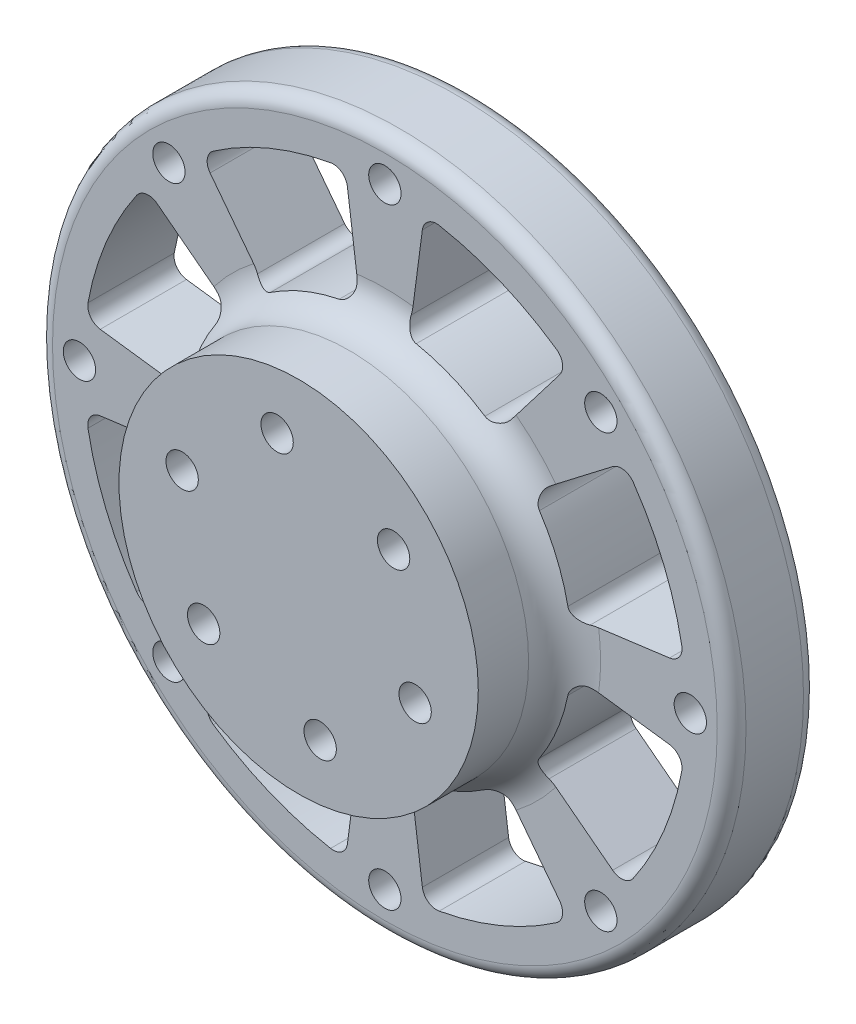
from build123d import *

# Parameters (mm, degrees)
SKETCH_1_R          = 48.25
SKETCH_1_R_2        = 2.25
EXTRUDE_1_DEPTH     = 12
SKETCH_2_R          = 25
SKETCH_2_R_2        = 2.25
EXTRUDE_3_DEPTH     = 12
CUT_EXTRUDE_START   = -53
SKETCH_5_R          = 2.25
CUT_EXTRUDE_2_DEPTH = 53
FILLET_1_R          = 5
FILLET_2_R          = 2
CUT_EXTRUDE_3_DEPTH = 53
FILLET_3_R          = 2


with BuildPart() as part:
    # 草图1 → 凸台-拉伸1 (new body)
    with BuildSketch(Plane.XY):
        Circle(SKETCH_1_R)
        with Locations((0, 42.5)):
            Circle(SKETCH_1_R_2, mode=Mode.SUBTRACT)
        with Locations((30.0520382, 30.0520382)):
            Circle(SKETCH_1_R_2, mode=Mode.SUBTRACT)
        with Locations((42.5, 0)):
            Circle(SKETCH_1_R_2, mode=Mode.SUBTRACT)
        with Locations((30.0520382, -30.0520382)):
            Circle(SKETCH_1_R_2, mode=Mode.SUBTRACT)
        with Locations((0, -42.5)):
            Circle(SKETCH_1_R_2, mode=Mode.SUBTRACT)
        with Locations((-30.0520382, -30.0520382)):
            Circle(SKETCH_1_R_2, mode=Mode.SUBTRACT)
        with Locations((-42.5, 0)):
            Circle(SKETCH_1_R_2, mode=Mode.SUBTRACT)
        with Locations((-30.0520382, 30.0520382)):
            Circle(SKETCH_1_R_2, mode=Mode.SUBTRACT)
    extrude(amount=EXTRUDE_1_DEPTH)

    # 草图2 → 凸台-拉伸3 (add)
    with BuildSketch(Plane.XY.offset(12)):
        Circle(SKETCH_2_R)
        with Locations((2.995431065, -16.987933739)):
            Circle(SKETCH_2_R_2, mode=Mode.SUBTRACT)
        with Locations((-2.995431065, 16.987933739)):
            Circle(SKETCH_2_R_2, mode=Mode.SUBTRACT)
        with Locations((16.209697709, -5.899847472)):
            Circle(SKETCH_2_R_2, mode=Mode.SUBTRACT)
        with Locations((13.214266644, 11.088086267)):
            Circle(SKETCH_2_R_2, mode=Mode.SUBTRACT)
        with Locations((-13.214266644, -11.088086267)):
            Circle(SKETCH_2_R_2, mode=Mode.SUBTRACT)
        with Locations((-16.209697709, 5.899847472)):
            Circle(SKETCH_2_R_2, mode=Mode.SUBTRACT)
    extrude(amount=EXTRUDE_3_DEPTH)

    # 草图5 → 切除-拉伸2 (cut)
    with BuildSketch(Plane.XY.offset(24).offset(CUT_EXTRUDE_START)):
        with Locations((2.995431065, -16.987933739)):
            Circle(SKETCH_5_R)
        with Locations((16.209697709, -5.899847472)):
            Circle(SKETCH_5_R)
        with Locations((13.214266644, 11.088086267)):
            Circle(SKETCH_5_R)
        with Locations((-2.995431065, 16.987933739)):
            Circle(SKETCH_5_R)
        with Locations((-13.214266644, -11.088086267)):
            Circle(SKETCH_5_R)
        with Locations((-16.209697709, 5.899847472)):
            Circle(SKETCH_5_R)
    extrude(amount=CUT_EXTRUDE_2_DEPTH, mode=Mode.SUBTRACT)

    # 圆角1
    fillet_1_edges = [part.edges().sort_by_distance(p)[0] for p in [
        (-25, 0, 12),
    ]]
    fillet(fillet_1_edges, radius=FILLET_1_R)

    # 圆角2
    fillet_2_edges = [part.edges().sort_by_distance(p)[0] for p in [
        (-48.25, 0, 12),
        (-48.25, 0, 0),
    ]]
    fillet(fillet_2_edges, radius=FILLET_2_R)

    # 草图6 → 切除-拉伸3 (cut)
    with BuildSketch(Plane(origin=(0, 0, 0), x_dir=(-1, 0, 0), z_dir=(0, 0, -1))):
        with BuildLine():
            ThreePointArc((-16.436558583, 21.420540188), (-10.332452674, 24.944747378), (-3.52420719, 26.769011257))
            Line((-3.52420719, 26.769011257), (-5.482100073, 41.640684178))
            ThreePointArc((-5.482100073, 41.640684178), (-16.072704159, 38.802940365), (-25.567980018, 33.320840292))
            Line((-25.567980018, 33.320840292), (-16.436558583, 21.420540188))
        make_face()
        with BuildLine():
            Line((5.482100073, 41.640684178), (3.52420719, 26.769011257))
            ThreePointArc((3.52420719, 26.769011257), (10.332452674, 24.944747378), (16.436558583, 21.420540188))
            Line((16.436558583, 21.420540188), (25.567980018, 33.320840292))
            ThreePointArc((25.567980018, 33.320840292), (16.072704159, 38.802940365), (5.482100073, 41.640684178))
        make_face()
        with BuildLine():
            Line((33.320840292, 25.567980018), (21.420540188, 16.436558583))
            ThreePointArc((21.420540188, 16.436558583), (24.944747378, 10.332452674), (26.769011257, 3.52420719))
            Line((26.769011257, 3.52420719), (41.640684178, 5.482100073))
            ThreePointArc((41.640684178, 5.482100073), (38.802940365, 16.072704159), (33.320840292, 25.567980018))
        make_face()
        with BuildLine():
            Line((41.640684178, -5.482100073), (26.769011257, -3.52420719))
            ThreePointArc((26.769011257, -3.52420719), (24.944747378, -10.332452674), (21.420540188, -16.436558583))
            Line((21.420540188, -16.436558583), (33.320840292, -25.567980018))
            ThreePointArc((33.320840292, -25.567980018), (38.802940365, -16.072704159), (41.640684178, -5.482100073))
        make_face()
        with BuildLine():
            Line((25.567980018, -33.320840292), (16.436558583, -21.420540188))
            ThreePointArc((16.436558583, -21.420540188), (10.332452674, -24.944747378), (3.52420719, -26.769011257))
            Line((3.52420719, -26.769011257), (5.482100073, -41.640684178))
            ThreePointArc((5.482100073, -41.640684178), (16.072704159, -38.802940365), (25.567980018, -33.320840292))
        make_face()
        with BuildLine():
            Line((-5.482100073, -41.640684178), (-3.52420719, -26.769011257))
            ThreePointArc((-3.52420719, -26.769011257), (-10.332452674, -24.944747378), (-16.436558583, -21.420540188))
            Line((-16.436558583, -21.420540188), (-25.567980018, -33.320840292))
            ThreePointArc((-25.567980018, -33.320840292), (-16.072704159, -38.802940365), (-5.482100073, -41.640684178))
        make_face()
        with BuildLine():
            Line((-33.320840292, -25.567980018), (-21.420540188, -16.436558583))
            ThreePointArc((-21.420540188, -16.436558583), (-24.944747378, -10.332452674), (-26.769011257, -3.52420719))
            Line((-26.769011257, -3.52420719), (-41.640684178, -5.482100073))
            ThreePointArc((-41.640684178, -5.482100073), (-38.802940365, -16.072704159), (-33.320840292, -25.567980018))
        make_face()
        with BuildLine():
            Line((-41.640684178, 5.482100073), (-26.769011257, 3.52420719))
            ThreePointArc((-26.769011257, 3.52420719), (-24.944747378, 10.332452674), (-21.420540188, 16.436558583))
            Line((-21.420540188, 16.436558583), (-33.320840292, 25.567980018))
            ThreePointArc((-33.320840292, 25.567980018), (-38.802940365, 16.072704159), (-41.640684178, 5.482100073))
        make_face()
    extrude(amount=-CUT_EXTRUDE_3_DEPTH, mode=Mode.SUBTRACT)

    # 圆角3
    fillet_3_edges = [part.edges().sort_by_distance(p)[0] for p in [
        (-26.769011257, 3.52420719, 6.5),
        (-21.420540188, 16.436558583, 6.5),
        (-33.320840292, 25.567980018, 6),
        (-41.640684178, 5.482100073, 6),
        (-5.482100073, 41.640684178, 6),
        (-25.567980018, 33.320840292, 6),
        (-3.52420719, 26.769011257, 6.5),
        (-16.436558583, 21.420540188, 6.5),
        (16.436558583, 21.420540188, 6.5),
        (3.52420719, 26.769011257, 6.5),
        (25.567980018, 33.320840292, 6),
        (5.482100073, 41.640684178, 6),
        (41.640684178, 5.482100073, 6),
        (33.320840292, 25.567980018, 6),
        (21.420540188, 16.436558583, 6.5),
        (26.769011257, 3.52420719, 6.5),
        (41.640684178, -5.482100073, 6),
        (26.769011257, -3.52420719, 6.5),
        (21.420540188, -16.436558583, 6.5),
        (33.320840292, -25.567980018, 6),
        (25.567980018, -33.320840292, 6),
        (5.482100073, -41.640684178, 6),
        (16.436558583, -21.420540188, 6.5),
        (3.52420719, -26.769011257, 6.5),
        (-3.52420719, -26.769011257, 6.5),
        (-16.436558583, -21.420540188, 6.5),
        (-5.482100073, -41.640684178, 6),
        (-25.567980018, -33.320840292, 6),
        (-33.320840292, -25.567980018, 6),
        (-41.640684178, -5.482100073, 6),
        (-26.769011257, -3.52420719, 6.5),
        (-21.420540188, -16.436558583, 6.5),
    ]]
    fillet(fillet_3_edges, radius=FILLET_3_R)


solid = part.part
